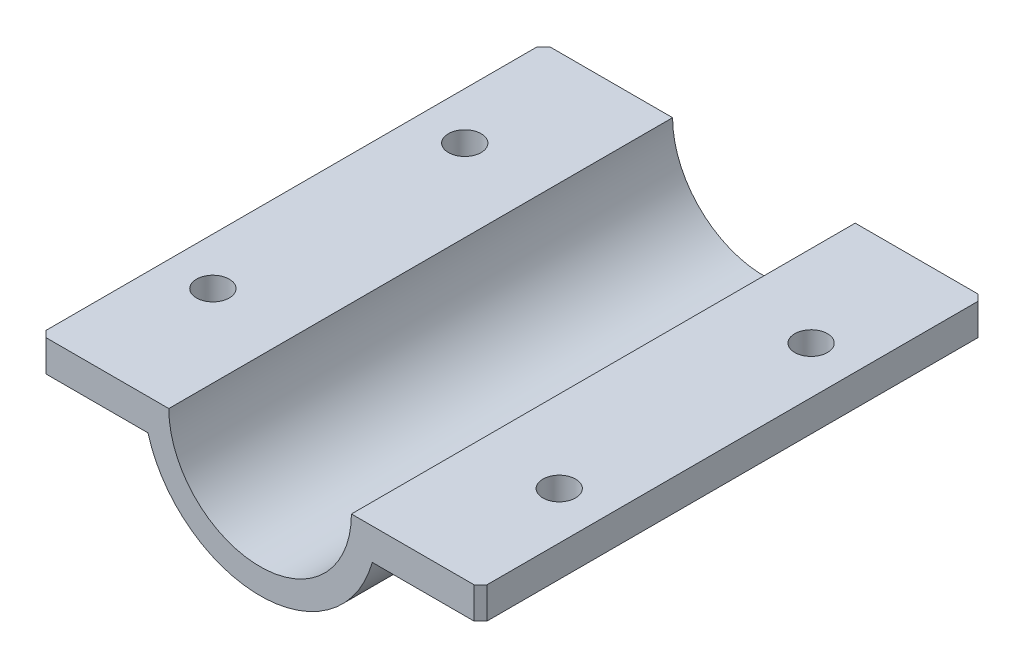
from build123d import *

# Parameters (mm, degrees)
EXTRUDE_1_DEPTH     = 40
SKETCH_2_R          = 2.6
CUT_EXTRUDE_1_DEPTH = 10
CHAMFER_1_SIZE      = 1


with BuildPart() as part:
    # 草图1 → 凸台-拉伸1 (new, symmetric)
    with BuildSketch(Plane.XY):
        with BuildLine():
            Line((35, 0), (14.5, 0))
            ThreePointArc((14.5, 0), (0, -14.5), (-14.5, 0))
            Line((-14.5, 0), (-35, 0))
            Line((-35, 0), (-35, -5))
            Line((-35, -5), (-21.937410968, -5))
            Line((-21.937410968, -5), (-17.811513131, -5))
            ThreePointArc((-17.811513131, -5), (0, -18.5), (17.811513131, -5))
            Line((17.811513131, -5), (21.937410968, -5))
            Line((21.937410968, -5), (35, -5))
            Line((35, -5), (35, 0))
        make_face()
    extrude(amount=EXTRUDE_1_DEPTH, both=True)

    # 草图2 → 切除-拉伸1 (cut)
    with BuildSketch(Plane(origin=(0, -5, 0), x_dir=(-1, 0, 0), z_dir=(0, -1, 0))):
        with Locations((27.5, -20)):
            Circle(SKETCH_2_R)
        with Locations((27.5, 20)):
            Circle(SKETCH_2_R)
        with Locations((-27.5, -20)):
            Circle(SKETCH_2_R)
        with Locations((-27.5, 20)):
            Circle(SKETCH_2_R)
    extrude(amount=-CUT_EXTRUDE_1_DEPTH, mode=Mode.SUBTRACT)

    # 倒角1
    chamfer_1_edges = [part.edges().sort_by_distance(p)[0] for p in [
        (-35, -2.5, -40),
        (35, -2.5, -40),
        (35, -2.5, 40),
        (-35, -2.5, 40),
    ]]
    chamfer(chamfer_1_edges, length=CHAMFER_1_SIZE)


solid = part.part
